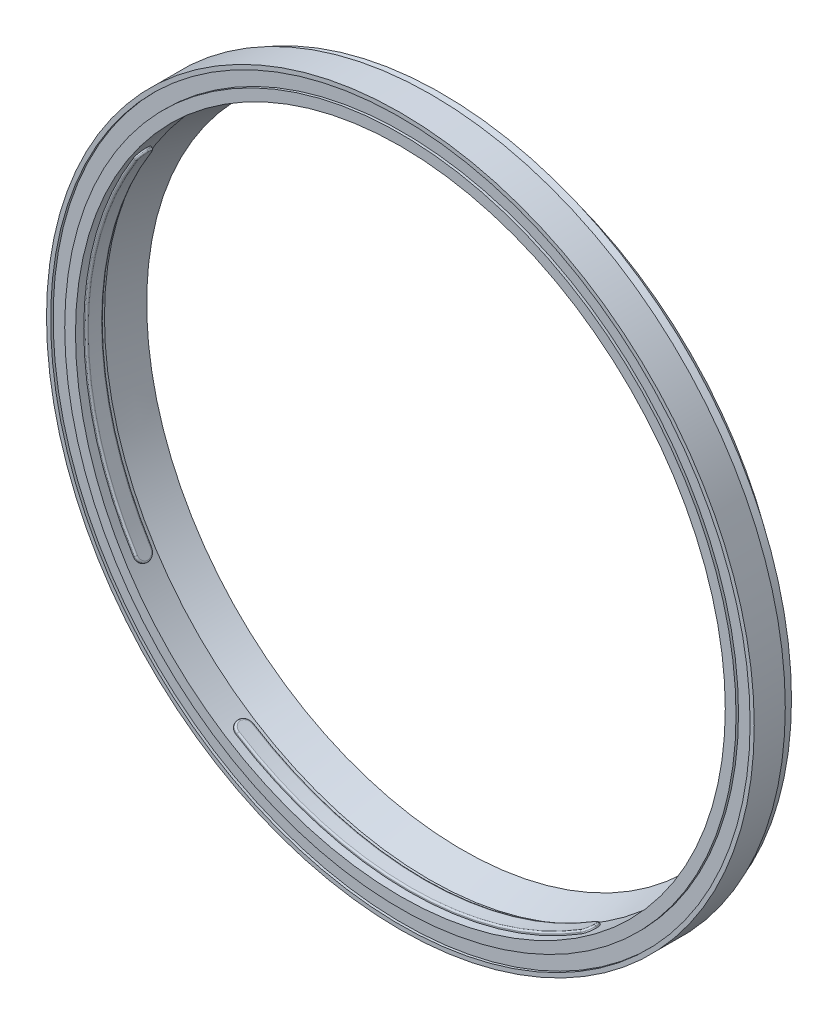
from build123d import *

# Parameters (mm, degrees)
BOSS_EXTRUDE1_DEPTH      = 2
FILLET1_R                = 1
FILLET2_R                = 0.2
CIRPATTERN1_COUNT        = 4
FILLET1_OF_CIRPATTERN1_R = 1
FILLET2_OF_CIRPATTERN1_R = 0.2


with BuildPart() as part:
    # Sketch1 → Revolve1 (revolve)
    with BuildSketch(Plane(origin=(0, 0, 0), x_dir=(0, 0, -1), z_dir=(1, 0, 0)), mode=Mode.PRIVATE) as revolve1_sk:
        with BuildLine():
            Line((3.75, 42.75), (3.75, 42.25))
            Line((3.75, 42.25), (3.75, 41.841613308))
            Line((3.75, 41.841613308), (5, 42.25))
            Line((5, 42.25), (5, 41.408386692))
            Line((5, 41.408386692), (3.973042318, 41.072870012))
            ThreePointArc((3.973042318, 41.072870012), (3.904476844, 40.986512483), (3.957039026, 40.889579186))
            Line((3.957039026, 40.889579186), (7.5, 39))
            Line((7.5, 39), (7.5, 38.15))
            Line((7.5, 38.15), (3.5, 39.25))
            Line((3.5, 39.25), (0, 39.25))
            Line((0, 39.25), (0, 40.55))
            Line((0, 40.55), (0.3, 40.55))
            Line((0.3, 40.55), (0.3, 42.25))
            Line((0.3, 42.25), (0, 42.25))
            Line((0, 42.25), (0, 42.75))
            Line((0, 42.75), (3.75, 42.75))
        make_face()
    revolve(revolve1_sk.sketch.rotate(Axis((0, 0, 0), (0, 0, -1)), 90), axis=Axis((0, 0, 0), (0, 0, -1)))

    # Sketch2 → Boss-Extrude1 (add)
    with BuildSketch(Plane.XY.offset(-1)):
        with BuildLine():
            Line((-21.69344473, 32.71019651), (-21.5, 32.418513229))
            ThreePointArc((-21.5, 32.418513229), (0, 38.9), (21.5, 32.418513229))
            Line((21.5, 32.418513229), (21.69344473, 32.71019651))
            ThreePointArc((21.69344473, 32.71019651), (0, 39.25), (-21.69344473, 32.71019651))
        make_face()
    boss_extrude1 = extrude(amount=-BOSS_EXTRUDE1_DEPTH)

    # Fillet1
    fillet1_edges = [part.edges().sort_by_distance(p)[0] for p in [
        (-21.596722365, 32.56435487, -3),
        (-21.596722365, 32.56435487, -1),
        (21.596722365, 32.56435487, -3),
        (21.596722365, 32.56435487, -1),
    ]]
    fillet(fillet1_edges, radius=FILLET1_R - 0.0001)  # a hair under: the kernel refuses the full size

    # Fillet2
    fillet2_edges = [part.edges().sort_by_distance(p)[0] for p in [
        (0, 38.9, -3),
        (0, 38.9, -1),
        (-21.255293634, 32.579479624, -1.292828231),
        (-21.255293634, 32.579479624, -2.707171769),
        (21.2552937, 32.579479581, -1.29282831),
        (21.255293684, 32.579479591, -2.707171669),
    ]]
    fillet(fillet2_edges, radius=FILLET2_R)

    # CirPattern1: Boss-Extrude1 ×4 about axis
    cirpattern1_axis = Axis((0, 0, 0), (0, 0, 1))
    for i in range(1, CIRPATTERN1_COUNT):
        add(boss_extrude1.rotate(cirpattern1_axis, i * 360 / CIRPATTERN1_COUNT))

    # Fillet1 of CirPattern1
    fillet1_of_cirpattern1_edges = [part.edges().sort_by_distance(p)[0] for p in [
        (-32.56435487, -21.596722365, -3),
        (-32.56435487, -21.596722365, -1),
        (-32.56435487, 21.596722365, -3),
        (-32.56435487, 21.596722365, -1),
        (21.596722365, -32.56435487, -3),
        (21.596722365, -32.56435487, -1),
        (-21.596722365, -32.56435487, -3),
        (-21.596722365, -32.56435487, -1),
        (32.56435487, 21.596722365, -3),
        (32.56435487, 21.596722365, -1),
        (32.56435487, -21.596722365, -3),
        (32.56435487, -21.596722365, -1),
    ]]
    fillet(fillet1_of_cirpattern1_edges, radius=FILLET1_OF_CIRPATTERN1_R - 0.0001)  # a hair under: the kernel refuses the full size

    # Fillet2 of CirPattern1
    fillet2_of_cirpattern1_edges = [part.edges().sort_by_distance(p)[0] for p in [
        (-38.9, 0, -3),
        (-38.9, 0, -1),
        (-32.579479624, -21.255293634, -1.292828231),
        (-32.579479624, -21.255293634, -2.707171769),
        (-32.579479581, 21.2552937, -1.29282831),
        (-32.579479591, 21.255293684, -2.707171669),
        (0, -38.9, -3),
        (0, -38.9, -1),
        (21.255293634, -32.579479624, -1.292828231),
        (21.255293634, -32.579479624, -2.707171769),
        (-21.2552937, -32.579479581, -1.29282831),
        (-21.255293684, -32.579479591, -2.707171669),
        (38.9, 0, -3),
        (38.9, 0, -1),
        (32.579479624, 21.255293634, -1.292828231),
        (32.579479624, 21.255293634, -2.707171769),
        (32.579479581, -21.2552937, -1.29282831),
        (32.579479591, -21.255293684, -2.707171669),
    ]]
    fillet(fillet2_of_cirpattern1_edges, radius=FILLET2_OF_CIRPATTERN1_R)


solid = part.part
